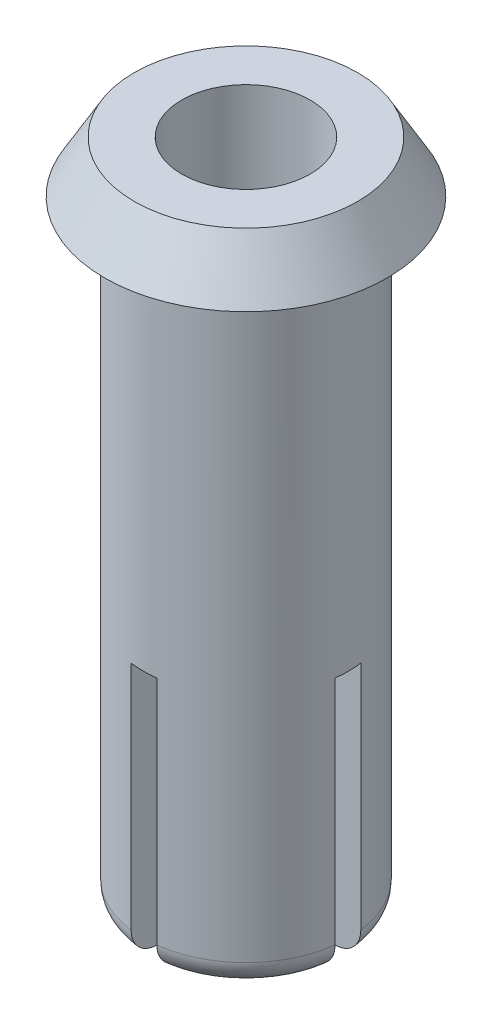
from build123d import *

# Parameters (mm, degrees)
ESQUISSE1_R             = 2
BOSS_EXTRU_1_DEPTH      = 13
ESQUISSE2_R             = 2.75
BOSS_EXTRU_2_DEPTH      = 1
ESQUISSE3_R             = 1.25
ENL_V_MAT_EXTRU_1_DEPTH = 14.569266745
CHANFREIN1_SIZE         = 1
CHANFREIN1_SIZE_2       = 0.577350269
CONG_2_R                = 0.5
ENL_V_MAT_EXTRU_2_DEPTH = 5


with BuildPart() as part:
    # Esquisse1 → Boss.-Extru.1 (new body)
    with BuildSketch(Plane(origin=(0, 0, 0), x_dir=(1, 0, 0), z_dir=(0, 1, 0))):
        with Locations(Location((0, 0, 0), (0, 0, 90))):
            Circle(ESQUISSE1_R)
    extrude(amount=BOSS_EXTRU_1_DEPTH)

    # Esquisse2 → Boss.-Extru.2 (add)
    with BuildSketch(Plane(origin=(0, 13, 0), x_dir=(1, 0, 0), z_dir=(0, 1, 0))):
        with Locations(Location((0, 0, 0), (0, 0, 270))):
            Circle(ESQUISSE2_R)
    extrude(amount=-BOSS_EXTRU_2_DEPTH)

    # Esquisse3 → Enlèv. mat.-Extru.1 (cut, through all)
    with BuildSketch(Plane(origin=(0, 13, 0), x_dir=(1, 0, 0), z_dir=(0, 1, 0))):
        with Locations(Location((0, 0, 0), (0, 0, 270))):
            Circle(ESQUISSE3_R)
    extrude(amount=-ENL_V_MAT_EXTRU_1_DEPTH, mode=Mode.SUBTRACT)

    # Chanfrein1
    # the kernel refuses this chamfer: 1, 0.577350269 mm, written as the material it takes off along each edge
    with BuildSketch(Plane(origin=(0, 13, 0), x_dir=(0, 0, 1), z_dir=(-1, 0, 0))) as chanfrein1_piece_1:
        Polygon((2.75, -CHANFREIN1_SIZE), (2.75 - CHANFREIN1_SIZE_2, 0), (2.75, 0), align=None)
    revolve(axis=Axis((0, 13, 0), (0, 1, 0)), mode=Mode.SUBTRACT)

    # Congé2
    cong_2_edges = [part.edges().sort_by_distance(p)[0] for p in [
        (0, 0, 2),
    ]]
    fillet(cong_2_edges, radius=CONG_2_R)

    # Esquisse4 → Enlèv. mat.-Extru.2 (cut)
    with BuildSketch(Plane.XZ):
        with BuildLine():
            Line((0.25, 1.984313483), (0.25, 1.224744871))
            ThreePointArc((0.25, 1.224744871), (0, 1.25), (-0.25, 1.224744871))
            Line((-0.25, 1.224744871), (-0.25, 1.984313483))
            ThreePointArc((-0.25, 1.984313483), (0, 2), (0.25, 1.984313483))
        make_face()
        with BuildLine():
            Line((1.984313483, 0.25), (1.224744871, 0.25))
            ThreePointArc((1.224744871, 0.25), (1.25, 0), (1.224744871, -0.25))
            Line((1.224744871, -0.25), (1.984313483, -0.25))
            ThreePointArc((1.984313483, -0.25), (2, 0), (1.984313483, 0.25))
        make_face()
        with BuildLine():
            Line((-1.224744871, -0.25), (-1.984313483, -0.25))
            ThreePointArc((-1.984313483, -0.25), (-2, 0), (-1.984313483, 0.25))
            Line((-1.984313483, 0.25), (-1.224744871, 0.25))
            ThreePointArc((-1.224744871, 0.25), (-1.25, 0), (-1.224744871, -0.25))
        make_face()
        with BuildLine():
            Line((0.25, -1.224744871), (0.25, -1.984313483))
            ThreePointArc((0.25, -1.984313483), (0, -2), (-0.25, -1.984313483))
            Line((-0.25, -1.984313483), (-0.25, -1.224744871))
            ThreePointArc((-0.25, -1.224744871), (0, -1.25), (0.25, -1.224744871))
        make_face()
    extrude(amount=-ENL_V_MAT_EXTRU_2_DEPTH, mode=Mode.SUBTRACT)


solid = part.part
